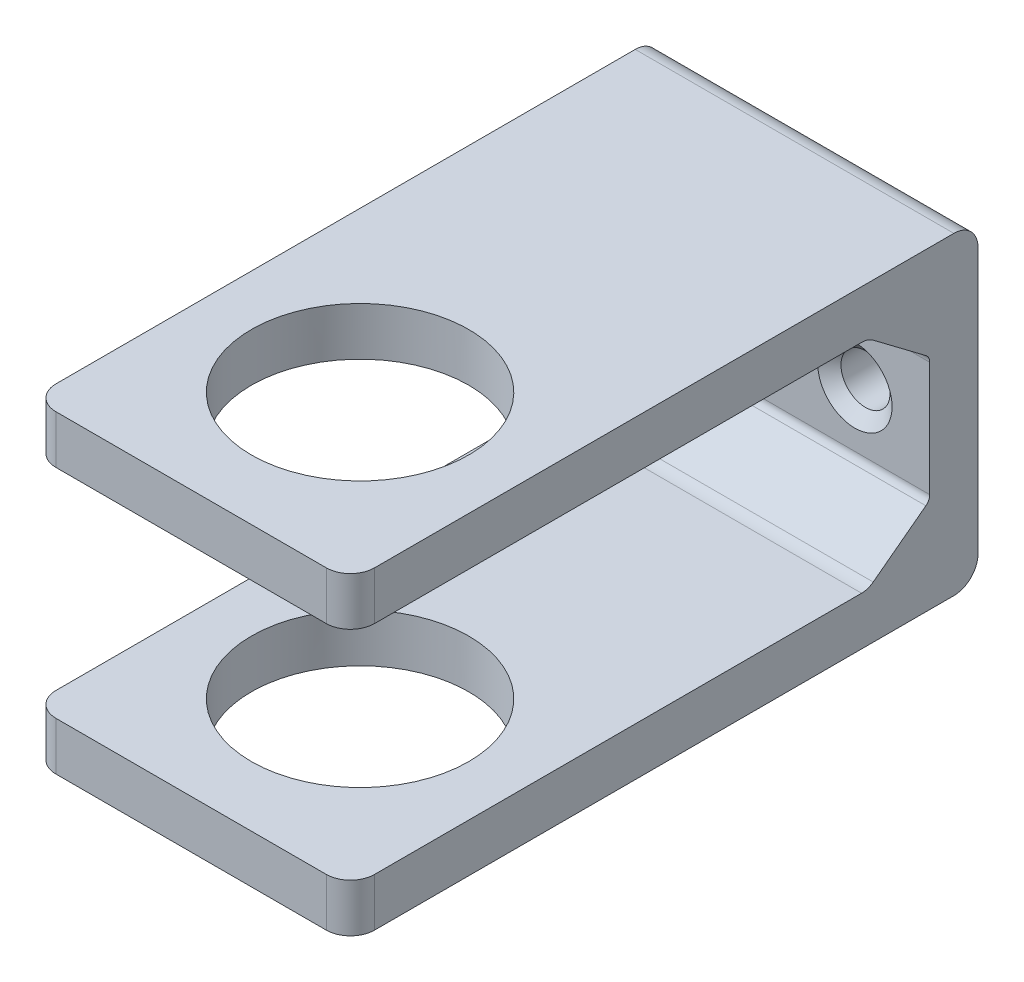
from build123d import *

# Parameters (mm, degrees)
SKETCH1_W                                          = 41.91
SKETCH1_H                                          = 82.55
BOSS_EXTRUDE1_DEPTH                                = 41.275
CUT_EXTRUDE6_DEPTH                                 = 72.858884976
SKETCH3_R                                          = 14.3002
CUT_EXTRUDE2_DEPTH                                 = 63.019055741
SKETCH4_R                                          = 3.2258
CUT_EXTRUDE3_DEPTH                                 = 95.642697288
FILLET2_R                                          = 3.175
CSK_FOR_10_FLAT_HEAD_MACHINE_SCREW_100_D           = 5.6134
CSK_FOR_10_FLAT_HEAD_MACHINE_SCREW_100_DEPTH       = 6.35
CSK_FOR_10_FLAT_HEAD_MACHINE_SCREW_100_CSINK_D     = 9.779
CSK_FOR_10_FLAT_HEAD_MACHINE_SCREW_100_CSINK_ANGLE = 100
CSK_FOR_10_FLAT_HEAD_MACHINE_SCREW_100_TIP         = 1.686435499
FILLET3_R                                          = 2.54
FILLET4_R                                          = 1.27


with BuildPart() as part:
    # Sketch1 → Boss-Extrude1 (new body)
    with BuildSketch(Plane(origin=(0, 0, 0), x_dir=(1, 0, 0), z_dir=(0, 1, 0))):
        Rectangle(SKETCH1_W, SKETCH1_H)
    extrude(amount=BOSS_EXTRUDE1_DEPTH)

    # Sketch13 → Cut-Extrude6 (cut, through all)
    with BuildSketch(Plane.ZY.offset(20.955)):
        Polygon((-26.810863218, 34.925), (-34.925, 28.810559365), (-34.925, 12.464440635), (-26.810863218, 6.35), (41.275, 6.35), (41.275, 34.925), align=None)
    extrude(amount=-CUT_EXTRUDE6_DEPTH, mode=Mode.SUBTRACT)

    # Sketch3 → Cut-Extrude2 (cut, through all)
    with BuildSketch(Plane(origin=(0, 41.275, 0), x_dir=(1, 0, 0), z_dir=(0, 1, 0))):
        with Locations((0, -19.05)):
            Circle(SKETCH3_R)
    extrude(amount=-CUT_EXTRUDE2_DEPTH, mode=Mode.SUBTRACT)

    # Sketch4 → Cut-Extrude3 (cut, through all)
    with BuildSketch(Plane(origin=(0, 0, -41.275), x_dir=(-1, 0, 0), z_dir=(0, 0, -1))):
        with Locations((11.1125, 20.6375)):
            Circle(SKETCH4_R)
        with Locations((-11.1125, 20.6375)):
            Circle(SKETCH4_R)
    extrude(amount=-CUT_EXTRUDE3_DEPTH, mode=Mode.SUBTRACT)

    # Fillet2
    fillet2_edges = [part.edges().sort_by_distance(p)[0] for p in [
        (0, 0, -41.275),
        (0, 41.275, -41.275),
        (-20.955, 3.175, 41.275),
        (20.955, 3.175, 41.275),
        (-20.955, 38.1, 41.275),
        (20.955, 38.1, 41.275),
    ]]
    fillet(fillet2_edges, radius=FILLET2_R)

    # CSK for #10 Flat Head Machine Screw (100)4
    with Locations(Plane.XY.offset(-34.925)):
        with Locations((-11.1125, 20.6375), (11.1125, 20.6375)):
            CounterSinkHole(CSK_FOR_10_FLAT_HEAD_MACHINE_SCREW_100_D / 2, CSK_FOR_10_FLAT_HEAD_MACHINE_SCREW_100_CSINK_D / 2, depth=CSK_FOR_10_FLAT_HEAD_MACHINE_SCREW_100_DEPTH, counter_sink_angle=CSK_FOR_10_FLAT_HEAD_MACHINE_SCREW_100_CSINK_ANGLE)
            with Locations((0, 0, -(CSK_FOR_10_FLAT_HEAD_MACHINE_SCREW_100_DEPTH + CSK_FOR_10_FLAT_HEAD_MACHINE_SCREW_100_TIP / 2))):  # 118° drill point
                Cone(0, CSK_FOR_10_FLAT_HEAD_MACHINE_SCREW_100_D / 2, CSK_FOR_10_FLAT_HEAD_MACHINE_SCREW_100_TIP, mode=Mode.SUBTRACT)

    # Fillet3
    fillet3_edges = [part.edges().sort_by_distance(p)[0] for p in [
        (0, 6.35, -26.810863218),
        (0, 34.925, -26.810863218),
    ]]
    fillet(fillet3_edges, radius=FILLET3_R)

    # Fillet4
    fillet4_edges = [part.edges().sort_by_distance(p)[0] for p in [
        (0, 12.464440635, -34.925),
        (0, 28.810559365, -34.925),
    ]]
    fillet(fillet4_edges, radius=FILLET4_R)


solid = part.part
